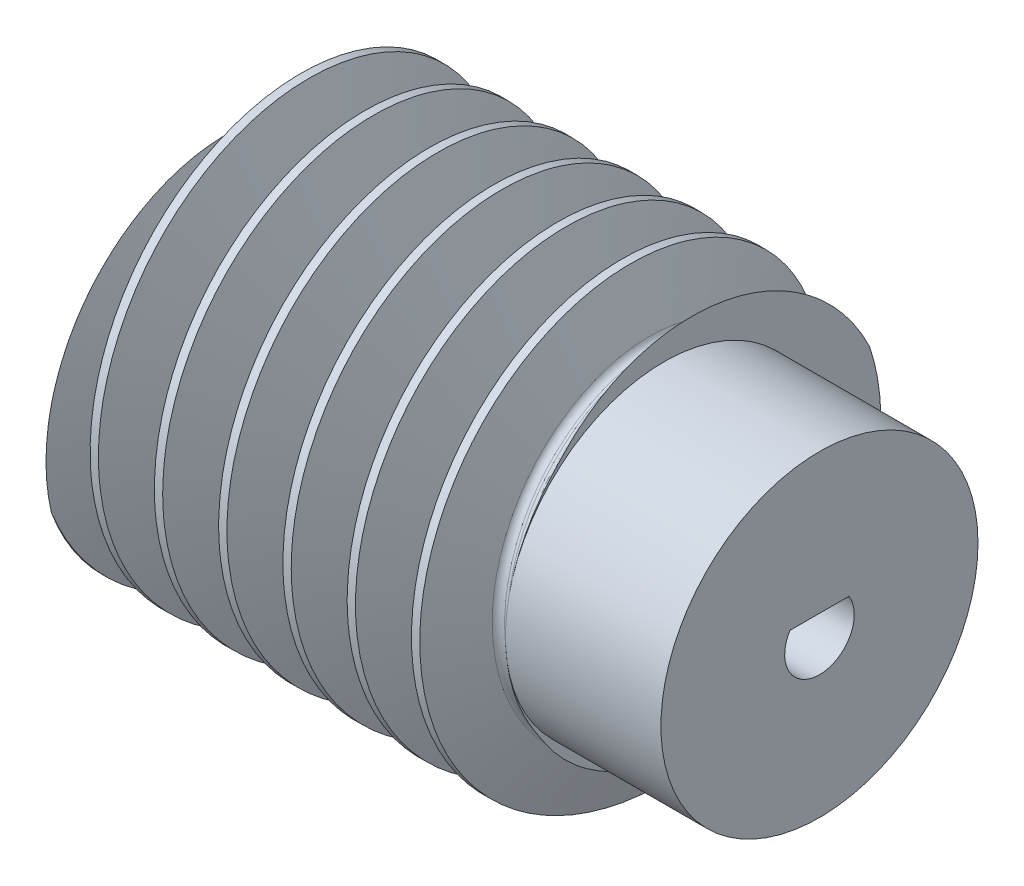
from build123d import *

# Parameters (mm, degrees)
SKETCH_1_W          = 20
SKETCH_1_H          = 10.6
SWEEP_1_PITCH       = 3.141592654
SKETCH_5_R          = 7.75
EXTRUDE_2_DEPTH     = 7.6
CUT_EXTRUDE_1_DEPTH = 20


with BuildPart() as part:
    # 草图1 → 旋转1 (revolve)
    with BuildSketch(Plane.XY, mode=Mode.PRIVATE) as revolve_1_sk:
        with Locations((10, 5.3)):
            Rectangle(SKETCH_1_W, SKETCH_1_H)
    revolve(revolve_1_sk.sketch.rotate(Axis((-56.849408284, 0, 0), (1, 0, 0)), 90), axis=Axis((-56.849408284, 0, 0), (1, 0, 0)))

    # 切除-扫描1: the profile of 草图3 profile screwed along a right-hand helix of 9.676621 turns, 10 arcs to a turn; built about Z, then put on its axis
    sweep_1_z = Axis((0, 0, 0), (0, 0, 1))
    sweep_1_corners = [(10.6003, 0, -4.103360806), (10.6003, 0, -1.367641347), (8.000032346, 0, -2.314061375), (7.75, 0, -2.67114457), (7.75, 0, -2.799857582), (8.000032346, 0, -3.156940778)]
    with BuildLine(mode=Mode.PRIVATE) as sweep_1_profile:
        Line(sweep_1_corners[0], sweep_1_corners[1])
        Line(sweep_1_corners[1], sweep_1_corners[2])
        Line(sweep_1_corners[3], sweep_1_corners[4])
        Line(sweep_1_corners[5], sweep_1_corners[0])
        ThreePointArc((8.000032346, 0, -2.314061375), (7.818722223, 0, -2.453185525), (7.75, 0, -2.67114457))
        ThreePointArc((7.75, 0, -2.799857582), (7.818722223, 0, -3.017816628), (8.000032346, 0, -3.156940778))
    sweep_1_cap = Face(sweep_1_profile.wire())
    sweep_1_arcs = [((8.000032346, 0, -2.314061375), (7.75, 0, -2.405065706), (7.75, 0, -2.67114457), (1, 0.8191520442889924, 1)), ((7.75, 0, -2.799857582), (7.75, 0, -3.065936447), (8.000032346, 0, -3.156940778), (1, 0.8191520442889897, 1))]  # start, shoulder, end, weights
    sweep_1_turn_angles = [0, 18, 36, 54, 72, 90, 108, 126, 144, 162, 180, 198, 216, 234, 252, 270, 288, 306, 324, 342, 360]
    sweep_1_turn_weights = [1, 0.9510565162951535, 1, 0.9510565162951535, 1, 0.9510565162951535, 1, 0.9510565162951535, 1, 0.9510565162951535, 1, 0.9510565162951535, 1, 0.9510565162951535, 1, 0.9510565162951535, 1, 0.9510565162951535, 1, 0.9510565162951535, 1]
    sweep_1_turn_rails = [Edge.make_bspline([Vector(p[0], p[1], 0).rotate(sweep_1_z, sweep_1_turn_angles[k]) / sweep_1_turn_weights[k] + Vector(0, 0, p[2] + SWEEP_1_PITCH * sweep_1_turn_angles[k] / 360) for k in range(21)], [0, 0, 0, 1, 1, 2, 2, 3, 3, 4, 4, 5, 5, 6, 6, 7, 7, 8, 8, 9, 9, 10, 10, 10], 2, sweep_1_turn_weights) for p in sweep_1_corners]
    sweep_1_turn_sides = [*[Face.make_surface_from_curves(sweep_1_turn_rails[p[0]], sweep_1_turn_rails[p[1]]) for p in [(0, 1), (1, 2), (3, 4), (5, 0)]], *[Face.make_bezier_surface([[Vector(p[j][0], p[j][1], 0).rotate(sweep_1_z, sweep_1_turn_angles[2 * i + k]) / sweep_1_turn_weights[2 * i + k] + Vector(0, 0, p[j][2] + SWEEP_1_PITCH * sweep_1_turn_angles[2 * i + k] / 360) for k in range(3)] for j in range(3)], [[p[3][j] * sweep_1_turn_weights[2 * i + k] for k in range(3)] for j in range(3)]) for p in sweep_1_arcs for i in range(10)]]
    sweep_1_last_angles = [3240, 3258, 3276, 3294, 3312, 3330, 3348, 3366, 3384, 3402, 3420, 3438, 3456, 3469.791697198, 3483.583394395]
    sweep_1_last_weights = [1, 0.9510565162951535, 1, 0.9510565162951535, 1, 0.9510565162951535, 1, 0.9510565162951535, 1, 0.9510565162951535, 1, 0.9510565162951535, 1, 0.9711688358913783, 1]
    sweep_1_last_rails = [Edge.make_bspline([Vector(p[0], p[1], 0).rotate(sweep_1_z, sweep_1_last_angles[k]) / sweep_1_last_weights[k] + Vector(0, 0, p[2] + SWEEP_1_PITCH * sweep_1_last_angles[k] / 360) for k in range(15)], [0, 0, 0, 1, 1, 2, 2, 3, 3, 4, 4, 5, 5, 6, 6, 7, 7, 7], 2, sweep_1_last_weights) for p in sweep_1_corners]
    sweep_1_last_sides = [*[Face.make_surface_from_curves(sweep_1_last_rails[p[0]], sweep_1_last_rails[p[1]]) for p in [(0, 1), (1, 2), (3, 4), (5, 0)]], *[Face.make_bezier_surface([[Vector(p[j][0], p[j][1], 0).rotate(sweep_1_z, sweep_1_last_angles[2 * i + k]) / sweep_1_last_weights[2 * i + k] + Vector(0, 0, p[j][2] + SWEEP_1_PITCH * sweep_1_last_angles[2 * i + k] / 360) for k in range(3)] for j in range(3)], [[p[3][j] * sweep_1_last_weights[2 * i + k] for k in range(3)] for j in range(3)]) for p in sweep_1_arcs for i in range(7)]]
    sweep_1 = Plane(origin=(0, 0, 0), x_dir=(0, 1, 0), z_dir=(1, 0, 0)) * Solid(Shell([*[p.moved(Location((0, 0, SWEEP_1_PITCH * i))) for i in range(9) for p in sweep_1_turn_sides], *sweep_1_last_sides, sweep_1_cap, sweep_1_cap.rotate(sweep_1_z, 3483.583394395).moved(Location((0, 0, SWEEP_1_PITCH * 3483.583394395 / 360)))]))
    add(sweep_1, mode=Mode.SUBTRACT)

    # 草图5 → 凸台-拉伸2 (add)
    with BuildSketch(Plane(origin=(20, 0, 0), x_dir=(0, 0, -1), z_dir=(1, 0, 0))):
        with Locations(Location((0, 0, 0), (0, 0, 182.628424188))):
            Circle(SKETCH_5_R)
    extrude(amount=EXTRUDE_2_DEPTH)

    # 草图6 → 切除-拉伸1 (cut)
    with BuildSketch(Plane(origin=(27.6, 0, 0), x_dir=(0, 0, -1), z_dir=(1, 0, 0))):
        with BuildLine():
            Line((-1.44222051, 0.9), (1.44222051, 0.9))
            ThreePointArc((1.44222051, 0.9), (0, -1.7), (-1.44222051, 0.9))
        make_face()
    extrude(amount=-CUT_EXTRUDE_1_DEPTH, mode=Mode.SUBTRACT)


solid = part.part
